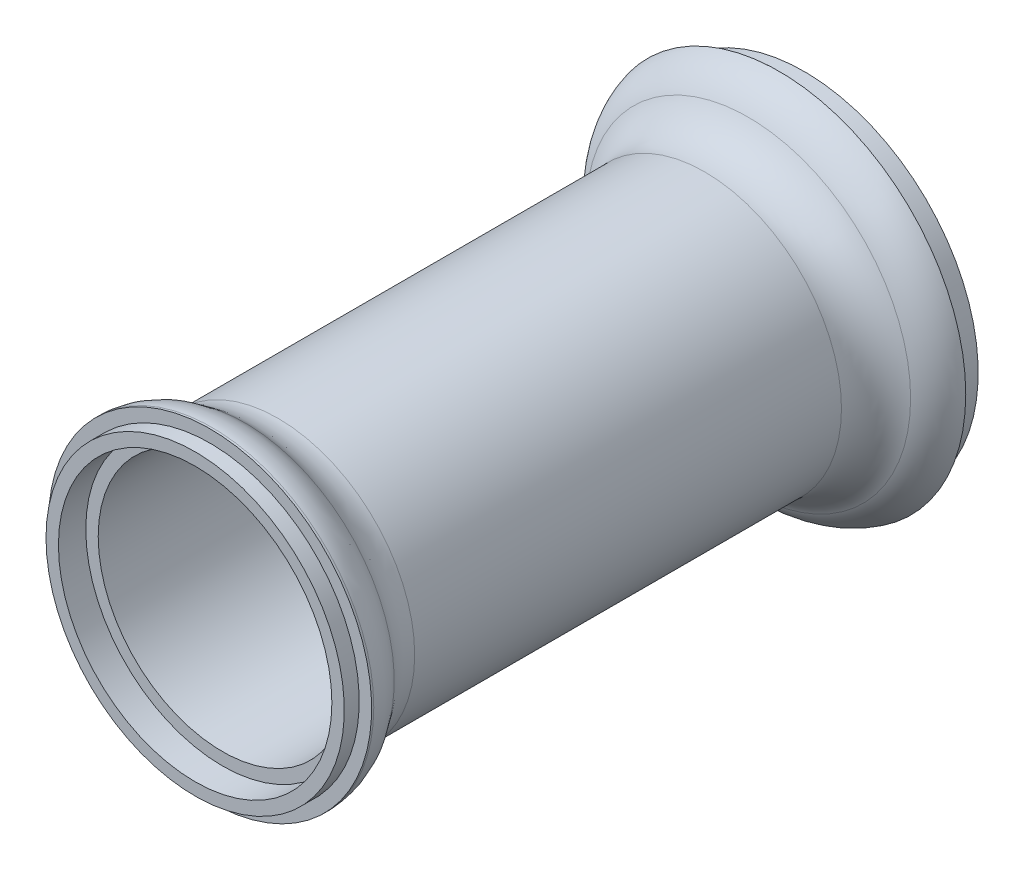
from build123d import *

# Parameters (mm, degrees)
SHELL1_OUTLINE_R     = 25
SHELL1_DEPTH         = 122.5
SHELL1_2_OUTLINE_R   = 32.5
SHELL1_2_OUTLINE_R_2 = 25
SHELL1_2_DEPTH       = 7.5
SHELL1_START         = 117
SHELL1_3_OUTLINE_R   = 27.5
SHELL1_3_OUTLINE_R_2 = 25
SHELL1_3_DEPTH       = 5.5
FILLET1_R            = 10
FILLET2_R            = 10


# Read off the part's stored shape, not the designer's step: Shell1
with BuildPart() as part:
    # Sketch1 → Revolve1 (revolve)
    with BuildSketch(Plane(origin=(0, 0, 0), x_dir=(1, 0, 0), z_dir=(0, 1, 0)), mode=Mode.PRIVATE) as revolve1_sk:
        Polygon((0, 0), (0, -122.5), (30, -122.5), (30, -119.5), (32.5, -119.5), (32.5, -114.5), (27.5, -114.5), (27.5, -10), (37.5, -10), (37.5, -5), (35, -5), (35, 0), align=None)
    revolve(revolve1_sk.sketch.rotate(Axis((0, 0, 0), (0, 0, 1)), 180), axis=Axis((0, 0, 0), (0, 0, 1)))

    # Shell1 outline → Shell1 (cut)
    with BuildSketch(Plane.XY):
        Circle(SHELL1_OUTLINE_R)
    extrude(amount=SHELL1_DEPTH, mode=Mode.SUBTRACT)

    # Shell1 2 outline → Shell1 2 (cut)
    with BuildSketch(Plane.XY):
        Circle(SHELL1_2_OUTLINE_R)
        Circle(SHELL1_2_OUTLINE_R_2, mode=Mode.SUBTRACT)
    extrude(amount=SHELL1_2_DEPTH, mode=Mode.SUBTRACT)

    # Shell1 3 outline → Shell1 3 (cut)
    with BuildSketch(Plane.XY.offset(SHELL1_START)):
        Circle(SHELL1_3_OUTLINE_R)
        Circle(SHELL1_3_OUTLINE_R_2, mode=Mode.SUBTRACT)
    extrude(amount=SHELL1_3_DEPTH, mode=Mode.SUBTRACT)

    # Fillet1
    # the kernel refuses this fillet: 10 mm, written as the material it adds along each edge
    with BuildSketch(Plane(origin=(0, 0, 10), x_dir=(-1, 0, 0), z_dir=(0, 1, 0))) as fillet1_piece_1:
        with BuildLine():
            CenterArc((27.5 + FILLET1_R, FILLET1_R), FILLET1_R, 180, 90)
            Line((27.5 + FILLET1_R, 0), (27.5 + FILLET1_R, -FILLET1_R * 0.02))
            Line((27.5 + FILLET1_R, -FILLET1_R * 0.02), (27.5 - FILLET1_R * 0.02, -FILLET1_R * 0.02))
            Line((27.5 - FILLET1_R * 0.02, -FILLET1_R * 0.02), (27.5 - FILLET1_R * 0.02, FILLET1_R))
            Line((27.5 - FILLET1_R * 0.02, FILLET1_R), (27.5, FILLET1_R))
        make_face()
    revolve(axis=Axis((0, 0, 10), (0, 0, 1)))
    with BuildSketch(Plane(origin=(0, 0, 114.5), x_dir=(-1, 0, 0), z_dir=(0, 1, 0))) as fillet1_piece_2:
        with BuildLine():
            CenterArc((37.5, -8.660254038), FILLET1_R, 120, 60)
            Line((27.5, -8.660254038), (27.3, -8.660254038))
            Line((27.3, -8.660254038), (27.3, 0))
            Line((27.3, 0), (27.5, 0.2))
            ThreePointArc((27.5, 0.2), (30, 0.2), (32.4, 0.173205081))
            Line((32.4, 0.173205081), (32.5, 0))
        make_face()
    revolve(axis=Axis((0, 0, 114.5), (0, 0, 1)))

    # Fillet2
    # the kernel refuses this fillet: 10 mm, written as the material it takes off along each edge
    with BuildSketch(Plane(origin=(0, 0, 10), x_dir=(-1, 0, 0), z_dir=(0, 1, 0))) as fillet2_piece_1:
        with BuildLine():
            CenterArc((27.817541634, -7.5), FILLET2_R, 14.477512186, 46.567463442)
            Line((37.5, -5), (37.693649167, -4.95))
            ThreePointArc((37.693649167, -4.95), (37.7, -2.5), (37.7, 0))
            Line((37.7, 0), (37.5, 0.2))
            ThreePointArc((37.5, 0.2), (35.05, 0.511190802), (32.755595401, 1.425))
            Line((32.755595401, 1.425), (32.658770817, 1.25))
        make_face()
    revolve(axis=Axis((0, 0, 10), (0, 0, 1)), mode=Mode.SUBTRACT)
    with BuildSketch(Plane(origin=(0, 0, 114.5), x_dir=(-1, 0, 0), z_dir=(0, 1, 0))) as fillet2_piece_2:
        with BuildLine():
            CenterArc((22.5, 4.568502517), FILLET2_R, 318.590377891, 41.409622109)
            Line((32.5, 4.568502517), (32.7, 4.568502517))
            Line((32.7, 4.568502517), (32.7, 0))
            Line((32.7, 0), (32.6, -0.173205081))
            ThreePointArc((32.6, -0.173205081), (31.293504258, -1.076098804), (30.15, -2.178163326))
            Line((30.15, -2.178163326), (30, -2.04587576))
        make_face()
    revolve(axis=Axis((0, 0, 114.5), (0, 0, 1)), mode=Mode.SUBTRACT)


solid = part.part
